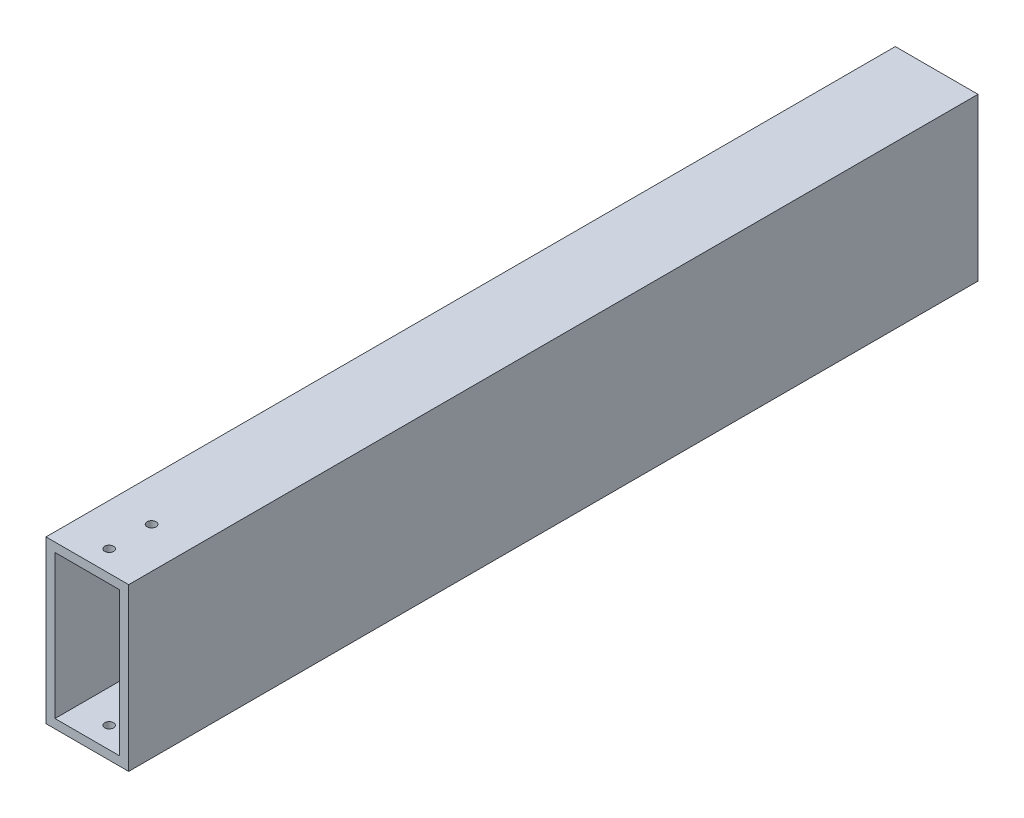
from build123d import *

# Parameters (mm, degrees)
SKETCH1_W           = 58.42
SKETCH1_H           = 114.3
BOSS_EXTRUDE1_DEPTH = 600
SKETCH2_W           = 45.72
SKETCH2_H           = 101.6
CUT_EXTRUDE1_DEPTH  = 60
SKETCH3_R           = 3.175
CUT_EXTRUDE2_DEPTH  = 614.005525995
SKETCH4_W           = 500
SKETCH4_H           = 10
CUT_EXTRUDE3_DEPTH  = 5


with BuildPart() as part:
    # Sketch1 → Boss-Extrude1 (new body)
    with BuildSketch(Plane.XY):
        with Locations((22.86, 50.8)):
            Rectangle(SKETCH1_W, SKETCH1_H)
    extrude(amount=-BOSS_EXTRUDE1_DEPTH)

    # Sketch2 → Cut-Extrude1 (cut)
    with BuildSketch(Plane.XY):
        with Locations((22.86, 50.8)):
            Rectangle(SKETCH2_W, SKETCH2_H)
    extrude(amount=-CUT_EXTRUDE1_DEPTH, mode=Mode.SUBTRACT)

    # Sketch3 → Cut-Extrude2 (cut, through all)
    with BuildSketch(Plane.XZ.offset(6.35)):
        with Locations((23.241, -45)):
            Circle(SKETCH3_R)
        with Locations((23.241, -15)):
            Circle(SKETCH3_R)
    extrude(amount=-CUT_EXTRUDE2_DEPTH, mode=Mode.SUBTRACT)

    # Sketch4 → Cut-Extrude3 (cut)
    with BuildSketch(Plane.ZY.offset(6.35)):
        with Locations((-300, 50.8)):
            Rectangle(SKETCH4_W, SKETCH4_H)
    extrude(amount=-CUT_EXTRUDE3_DEPTH, mode=Mode.SUBTRACT)


solid = part.part
